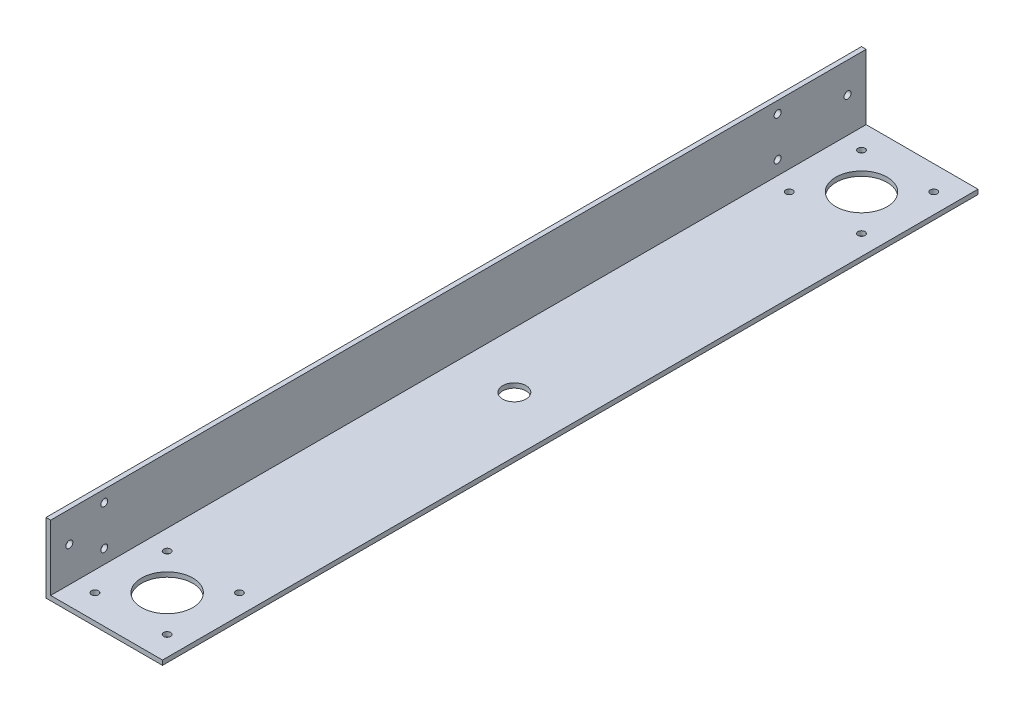
from build123d import *

# Parameters (mm, degrees)
BOSS_EXTRUDE1_DEPTH      = 350
SKETCH6_R                = 1.5
CUT_EXTRUDE3_DEPTH       = 355.660400947
SKETCH7_R                = 11
CUT_EXTRUDE4_DEPTH       = 355.660400947
SKETCH8_R                = 11
CUT_EXTRUDE5_DEPTH       = 355.823899984
SKETCH9_R                = 1.5
CUT_EXTRUDE6_DEPTH       = 355.823899984
SKETCH10_R               = 5
CUT_EXTRUDE7_DEPTH       = 355.823899984
F_3_0_3_DIAMETER_HOLE1_D = 3
F_3_0_3_DIAMETER_HOLE2_D = 3


with BuildPart() as part:
    # Sketch1 → Boss-Extrude1 (new body)
    with BuildSketch(Plane.XY):
        Polygon((0, 0), (0, 30), (2, 30), (2, 2), (50, 2), (50, 0), align=None)
    extrude(amount=BOSS_EXTRUDE1_DEPTH)

    # Sketch6 → Cut-Extrude3 (cut, through all)
    with BuildSketch(Plane(origin=(0, 2, 0), x_dir=(1, 0, 0), z_dir=(0, 1, 0))):
        with Locations((41.5, -339.5)):
            Circle(SKETCH6_R)
        with Locations((10.5, -308.5)):
            Circle(SKETCH6_R)
        with Locations((10.5, -339.5)):
            Circle(SKETCH6_R)
        with Locations((41.5, -308.5)):
            Circle(SKETCH6_R)
    extrude(amount=-CUT_EXTRUDE3_DEPTH, mode=Mode.SUBTRACT)

    # Sketch7 → Cut-Extrude4 (cut, through all)
    with BuildSketch(Plane(origin=(0, 2, 0), x_dir=(1, 0, 0), z_dir=(0, 1, 0))):
        with Locations((26, -324)):
            Circle(SKETCH7_R)
    extrude(amount=-CUT_EXTRUDE4_DEPTH, mode=Mode.SUBTRACT)

    # Sketch8 → Cut-Extrude5 (cut, through all)
    with BuildSketch(Plane(origin=(0, 0, 0), x_dir=(-1, 0, 0), z_dir=(0, -1, 0))):
        with Locations((-26, -26)):
            Circle(SKETCH8_R)
    extrude(amount=-CUT_EXTRUDE5_DEPTH, mode=Mode.SUBTRACT)

    # Sketch9 → Cut-Extrude6 (cut, through all)
    with BuildSketch(Plane.XZ):
        with Locations((41.5, 41.5)):
            Circle(SKETCH9_R)
        with Locations((10.5, 41.5)):
            Circle(SKETCH9_R)
        with Locations((10.5, 10.5)):
            Circle(SKETCH9_R)
        with Locations((41.5, 10.5)):
            Circle(SKETCH9_R)
    extrude(amount=-CUT_EXTRUDE6_DEPTH, mode=Mode.SUBTRACT)

    # Sketch10 → Cut-Extrude7 (cut, through all)
    with BuildSketch(Plane.XZ):
        with Locations((26.000000572, 175)):
            Circle(SKETCH10_R)
    extrude(amount=-CUT_EXTRUDE7_DEPTH, mode=Mode.SUBTRACT)

    # Ø3.0 (3) Diameter Hole1 (through all)
    with Locations(Plane(origin=(0, 141.67995168, 221.138003919), x_dir=(0, 0, 1), z_dir=(-1, 0, 0))):
        with Locations((105.861996081, -133.67995168), (120.861996081, -124.67995168), (105.861996081, -116.67995168)):
            Hole(F_3_0_3_DIAMETER_HOLE1_D / 2)

    # Ø3.0 (3) Diameter Hole2 (through all)
    with Locations(Plane(origin=(0, 141.67995168, 221.138003919), x_dir=(0, 0, 1), z_dir=(-1, 0, 0))):
        with Locations((-183.138003919, -133.67995168), (-213.138003919, -124.711209313), (-183.138003919, -116.67995168)):
            Hole(F_3_0_3_DIAMETER_HOLE2_D / 2)


solid = part.part
